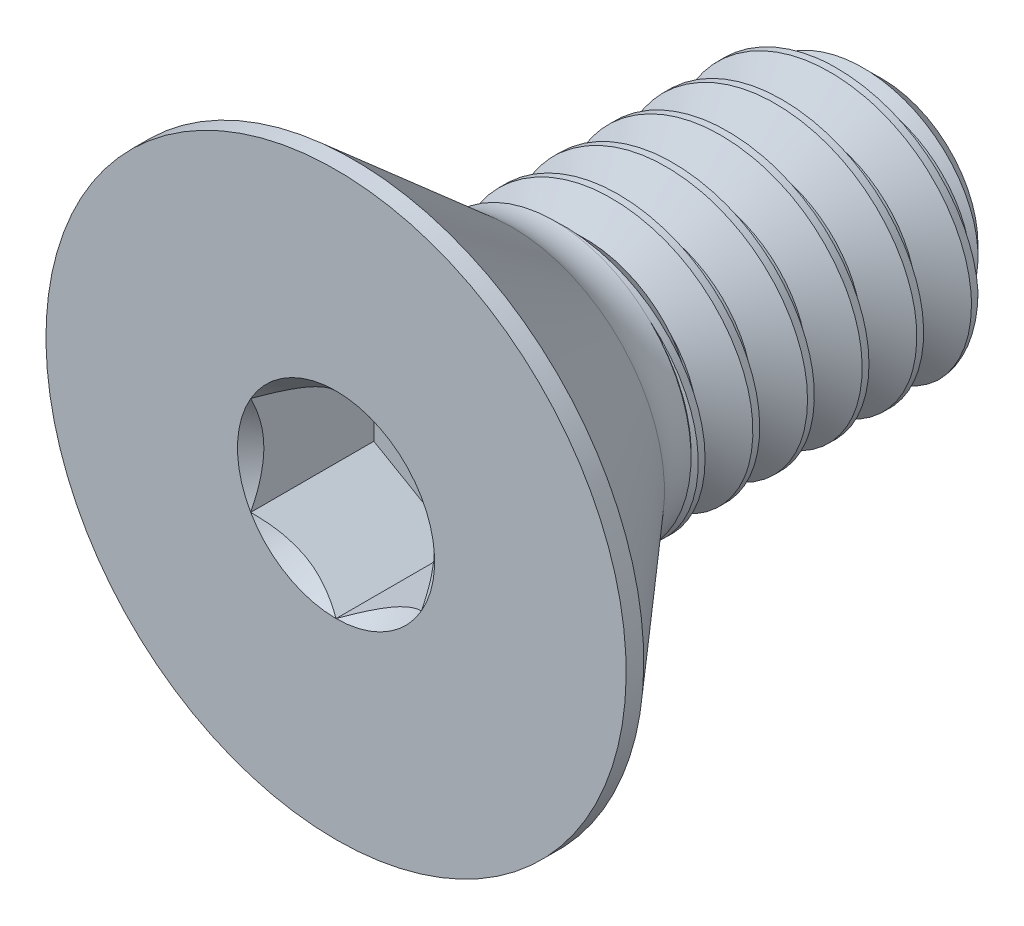
from build123d import *

# Parameters (mm, degrees)
SKETCH1_W          = 12.7
SKETCH1_H          = 3.175
CHAMFER1_SIZE      = 0.9525
CUT_SWEEP1_PITCH   = 1.27
CUT_EXTRUDE2_DEPTH = 2.86258


with BuildPart() as part:
    # Sketch1 → Revolve1 (revolve)
    with BuildSketch(Plane(origin=(0, 0, 0), x_dir=(0, 0, -1), z_dir=(1, 0, 0))):
        with Locations((6.35, 1.5875)):
            Rectangle(SKETCH1_W, SKETCH1_H)
    revolve(axis=Axis((0, 0, -12.7), (0, 0, 1)))

    # Chamfer1
    chamfer1_edges = [part.edges().sort_by_distance(p)[0] for p in [
        (0, -3.175, -12.7),
    ]]
    chamfer(chamfer1_edges, length=CHAMFER1_SIZE)

    # Cut-Sweep1: the profile of Sketch2 profile screwed along a right-hand helix of 10 turns, 8 arcs to a turn; built about Z, then put on its axis
    cut_sweep1_z = Axis((0, 0, 0), (0, 0, 1))
    cut_sweep1_corners = [(3.1756, 0, 0.00034641), (3.1756, 0, -1.11159641), (2.350110803, 0, -0.635), (2.350110803, 0, -0.47625)]
    with BuildLine(mode=Mode.PRIVATE) as cut_sweep1_profile:
        Line(cut_sweep1_corners[0], cut_sweep1_corners[1])
        Line(cut_sweep1_corners[1], cut_sweep1_corners[2])
        Line(cut_sweep1_corners[2], cut_sweep1_corners[3])
        Line(cut_sweep1_corners[3], cut_sweep1_corners[0])
    cut_sweep1_cap = Face(cut_sweep1_profile.wire())
    cut_sweep1_turn_angles = [0, 22.5, 45, 67.5, 90, 112.5, 135, 157.5, 180, 202.5, 225, 247.5, 270, 292.5, 315, 337.5, 360]
    cut_sweep1_turn_weights = [1, 0.9238795325112867, 1, 0.9238795325112867, 1, 0.9238795325112867, 1, 0.9238795325112867, 1, 0.9238795325112867, 1, 0.9238795325112867, 1, 0.9238795325112867, 1, 0.9238795325112867, 1]
    cut_sweep1_turn_rails = [Edge.make_bspline([Vector(p[0], p[1], 0).rotate(cut_sweep1_z, cut_sweep1_turn_angles[k]) / cut_sweep1_turn_weights[k] + Vector(0, 0, p[2] + CUT_SWEEP1_PITCH * cut_sweep1_turn_angles[k] / 360) for k in range(17)], [0, 0, 0, 1, 1, 2, 2, 3, 3, 4, 4, 5, 5, 6, 6, 7, 7, 8, 8, 8], 2, cut_sweep1_turn_weights) for p in cut_sweep1_corners]
    cut_sweep1_turn_sides = [Face.make_surface_from_curves(cut_sweep1_turn_rails[p[0]], cut_sweep1_turn_rails[p[1]]) for p in [(0, 1), (1, 2), (2, 3), (3, 0)]]
    cut_sweep1 = Plane(origin=(0, 0, -12.7), x_dir=(0, 1, 0), z_dir=(0, 0, 1)) * Solid(Shell([*[p.moved(Location((0, 0, CUT_SWEEP1_PITCH * i))) for i in range(10) for p in cut_sweep1_turn_sides], cut_sweep1_cap, cut_sweep1_cap.rotate(cut_sweep1_z, 3600).moved(Location((0, 0, CUT_SWEEP1_PITCH * 3600 / 360)))]))
    add(cut_sweep1, mode=Mode.SUBTRACT)


with BuildPart() as body_2:
    # Sketch7 → Revolve2 (revolve)
    with BuildSketch(Plane(origin=(0, 0, 0), x_dir=(0, 0, -1), z_dir=(1, 0, 0)), mode=Mode.PRIVATE) as revolve2_sk:
        with BuildLine():
            Line((0, 6.7437), (0.40894, 6.7437))
            Line((0.40894, 6.7437), (4.0894, 3.544324933))
            ThreePointArc((4.0894, 3.544324933), (4.549909788, 3.270350399), (5.077204404, 3.175))
            Line((5.077204404, 3.175), (5.077204404, 0))
            Line((5.077204404, 0), (0, 0))
            Line((0, 0), (0, 6.7437))
        make_face()
    revolve(revolve2_sk.sketch.rotate(Axis((0, 0, 0), (0, 0, -1)), 180), axis=Axis((0, 0, 0), (0, 0, -1)))

    # Boss-Extrude1 cone 1 section (through the dimple's axis) → Boss-Extrude1 (revolve)
    with BuildSketch(Plane(origin=(0, 0, -5.077204404), x_dir=(0, -1, 0), z_dir=(1, 0, 0))):
        Polygon((0, 0), (3.175, 0), (0, 3.175), align=None)
    revolve(axis=Axis((0, 0, -5.077204404), (0, 0, -1)))

    # Combine1: union part
    add(part.part)

    # Sketch5 → Cut-Extrude2 (cut)
    with BuildSketch(Plane.XY):
        Polygon((1.984375, -1.14567944), (1.984375, 1.14567944), (0, 2.291358881), (-1.984375, 1.14567944), (-1.984375, -1.14567944), (0, -2.291358881), align=None)
    extrude(amount=-CUT_EXTRUDE2_DEPTH, mode=Mode.SUBTRACT)

    # Cut-Extrude3 cone 1 section (through the dimple's axis) → Cut-Extrude3 (revolve, cut)
    with BuildSketch(Plane(origin=(0, 0, 0), x_dir=(0, -1, 0), z_dir=(1, 0, 0))):
        Polygon((0, 0), (2.291358881, 0), (0, 2.291358881), align=None)
    revolve(axis=Axis((0, 0, 0), (0, 0, -1)), mode=Mode.SUBTRACT)


solid = body_2.part
